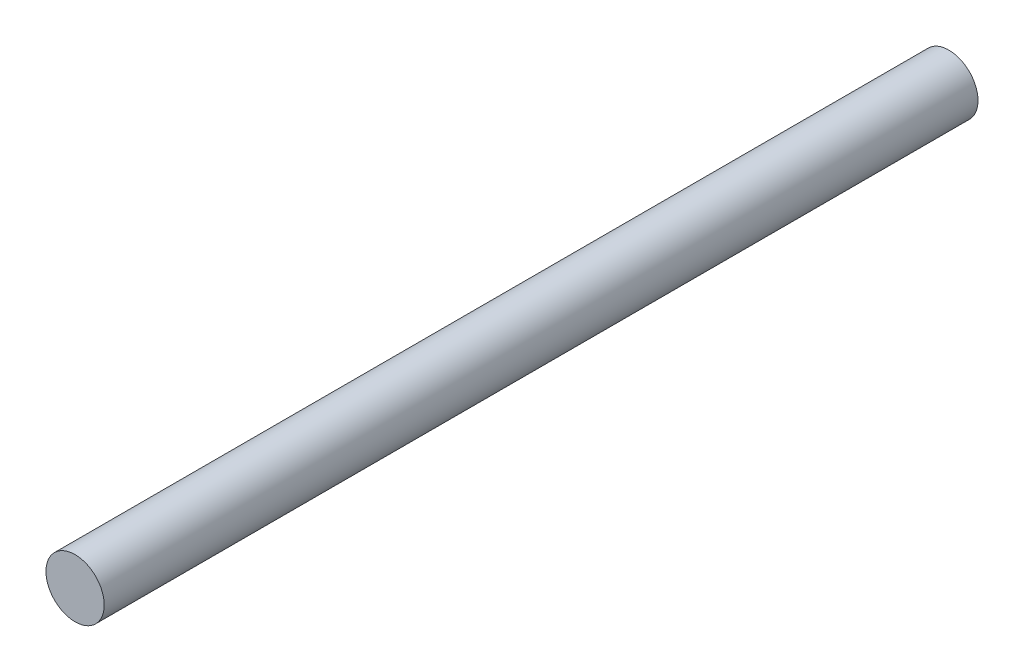
from build123d import *

# Parameters (mm, degrees)
SKETCH1_R = 4
ROD_DEPTH = 120


with BuildPart() as part:
    # Sketch1 → Rod (new body)
    with BuildSketch(Plane.XY):
        Circle(SKETCH1_R)
    extrude(amount=ROD_DEPTH)


solid = part.part
